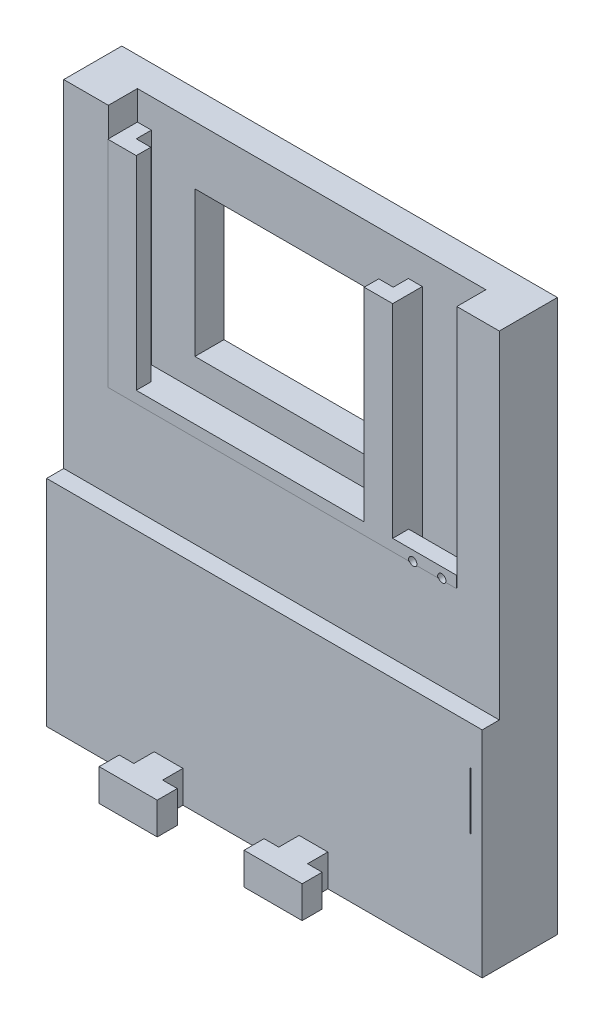
from build123d import *

# Parameters (mm, degrees)
SKETCH1_W           = 120
SKETCH1_H           = 80
BOSS_EXTRUDE1_DEPTH = 10
BOSS_EXTRUDE2_DEPTH = 70
SKETCH3_W           = 58.5
SKETCH3_H           = 50
CUT_EXTRUDE1_DEPTH  = 10
SKETCH5_W           = 120
SKETCH5_H           = 20.2
BOSS_EXTRUDE3_DEPTH = 4
BOSS_EXTRUDE5_DEPTH = 20
SKETCH7_W           = 150
SKETCH7_H           = 74
SKETCH7_W_2         = 0.268020534
SKETCH7_H_2         = 19.603817147
BOSS_EXTRUDE6_DEPTH = 5.9
BOSS_EXTRUDE7_DEPTH = 11
SKETCH21_W          = 21.9
SKETCH21_H          = 4.7
CUT_EXTRUDE7_DEPTH  = 5.5
SKETCH22_R          = 1.425
CUT_EXTRUDE8_DEPTH  = 5.5


with BuildPart() as part:
    # Sketch1 → Boss-Extrude1 (new body)
    with BuildSketch(Plane.XY):
        Rectangle(SKETCH1_W, SKETCH1_H)
    extrude(amount=BOSS_EXTRUDE1_DEPTH)

    # Sketch2 → Boss-Extrude2 (add)
    with BuildSketch(Plane.XZ.offset(40)):
        Polygon((-60, 10), (-55.2, 10), (-55.2, 15.2), (-50.2, 15.2), (-50.2, 20.2), (-60, 20.2), align=None)
        Polygon((33.3, 10), (38.1, 10), (38.1, 20.2), (28.3, 20.2), (28.3, 15.2), (33.3, 15.2), align=None)
    extrude(amount=-BOSS_EXTRUDE2_DEPTH)

    # Sketch3 → Cut-Extrude1 (cut)
    with BuildSketch(Plane.XY.offset(10)):
        with Locations((-10.95, -5)):
            Rectangle(SKETCH3_W, SKETCH3_H)
    extrude(amount=-CUT_EXTRUDE1_DEPTH, mode=Mode.SUBTRACT)

    # Sketch5 → Boss-Extrude3 (add)
    with BuildSketch(Plane(origin=(0, -40, 0), x_dir=(-1, 0, 0), z_dir=(0, -1, 0))):
        with Locations((0, -10.1)):
            Rectangle(SKETCH5_W, SKETCH5_H)
    extrude(amount=BOSS_EXTRUDE3_DEPTH)

    # Sketch6 → Boss-Extrude5 (add)
    with BuildSketch(Plane(origin=(0, 0, 0), x_dir=(-1, 0, 0), z_dir=(0, 0, -1))):
        Polygon((60, 40), (60, -44), (-60, -44), (-60, 40), (-74.627705057, 40), (-74.627705057, -150), (75.372294943, -150), (75.372294943, 40), align=None)
    extrude(amount=-BOSS_EXTRUDE5_DEPTH)

    # Sketch7 → Boss-Extrude6 (add)
    with BuildSketch(Plane.XY.offset(20)):
        with Locations((-0.372294943, -113)):
            Rectangle(SKETCH7_W, SKETCH7_H)
        with Locations((70.627340548, -99.185279167)):
            Rectangle(SKETCH7_W_2, SKETCH7_H_2, mode=Mode.SUBTRACT)
    extrude(amount=BOSS_EXTRUDE6_DEPTH)

    # Sketch8 → Boss-Extrude7 (add)
    with BuildSketch(Plane.XZ.offset(150)):
        Polygon((-43.372294943, 32.9), (-38.322294943, 32.9), (-38.322294943, 25.9), (-28.422294943, 25.9), (-28.422294943, 32.9), (-23.372294943, 32.9), (-23.372294943, 39.8), (-43.372294943, 39.8), align=None)
        Polygon((11.577705057, 32.9), (11.577705057, 25.9), (21.477705057, 25.9), (21.477705057, 32.9), (26.527705057, 32.9), (26.527705057, 39.8), (6.527705057, 39.8), (6.527705057, 32.9), align=None)
    extrude(amount=-BOSS_EXTRUDE7_DEPTH)

    # Sketch21 → Cut-Extrude7 (cut)
    with BuildSketch(Plane(origin=(0, -40, 0), x_dir=(1, 0, 0), z_dir=(0, 1, 0))):
        with Locations((49.05, -12.35)):
            Rectangle(SKETCH21_W, SKETCH21_H)
    extrude(amount=-CUT_EXTRUDE7_DEPTH, mode=Mode.SUBTRACT)

    # Sketch22 → Cut-Extrude8 (cut)
    with BuildSketch(Plane.XY.offset(20.2)):
        with Locations((55, -43.5)):
            Circle(SKETCH22_R)
        with Locations((45, -43.5)):
            Circle(SKETCH22_R)
    extrude(amount=-CUT_EXTRUDE8_DEPTH, mode=Mode.SUBTRACT)


solid = part.part
